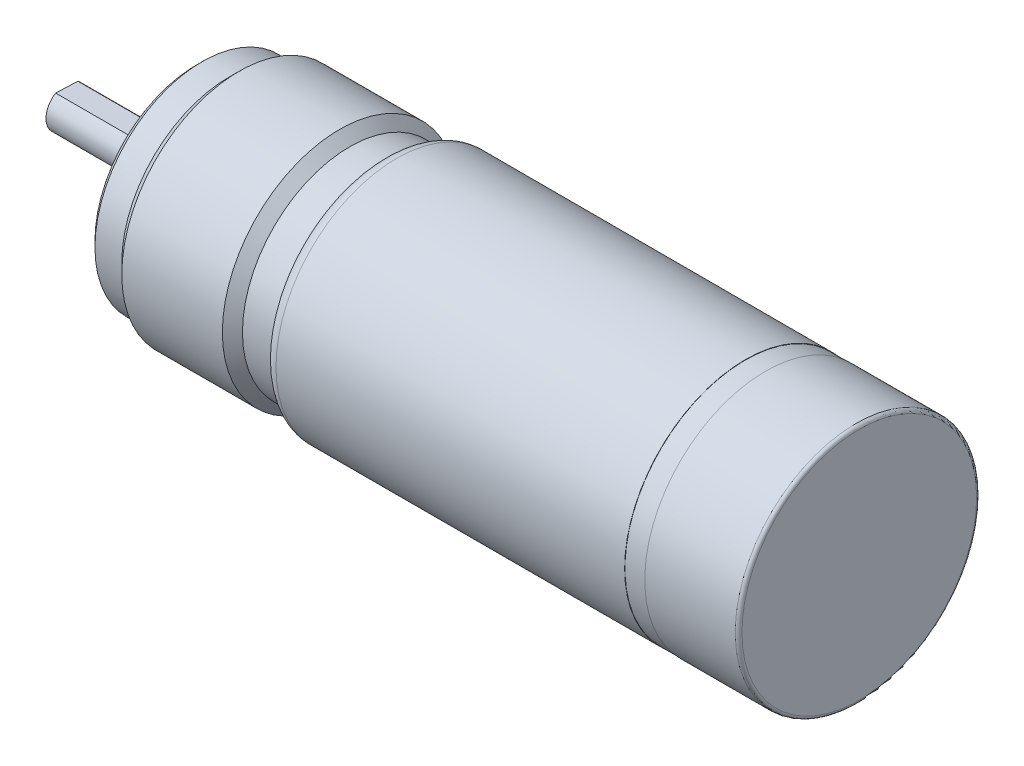
from build123d import *

# Parameters (mm, degrees)
SKETCH_1_W               = 16.3
SKETCH_1_H               = 3
SKETCH_1_W_2             = 5
SKETCH_1_H_2             = 16
SKETCH_19_W              = 3
SKETCH_19_H              = 0.05
EXTRUDE_START            = 14
SKETCH_20_R              = 18
EXTRUDE_2_DEPTH          = 14
CUT_EXTRUDE_6_DEPTH      = 3
CUT_EXTRUDE_4_DEPTH      = 12
SKETCH_13_R              = 1.5
CUT_EXTRUDE_8_DEPTH      = 7
PATTERN_CIRCULAR_2_COUNT = 4
FILLET_1_R               = 0.5


with BuildPart() as part:
    # Эскиз1 → Повернуть1 основной корпус (revolve)
    with BuildSketch(Plane(origin=(0, 0, 0), x_dir=(1, 0, 0), z_dir=(0, 1, 0)), mode=Mode.PRIVATE) as revolve_1_sk:
        with Locations((8.15, 1.5)):
            Rectangle(SKETCH_1_W, SKETCH_1_H)
        Polygon((16.3, 0), (19.3, 0), (19.3, 10), (16.3, 10), (16.3, 3), align=None)
        Polygon((24.3, 0), (24.3, 16), (20.3, 16), (19.3, 15), (19.3, 10), (19.3, 0), align=None)
        Polygon((40.8, 17.5), (42.3, 16), (42.3, 0), (24.3, 0), (24.3, 16), (25.8, 17.5), align=None)
        with Locations((44.8, 8)):
            Rectangle(SKETCH_1_W_2, SKETCH_1_H_2)
        with BuildLine():
            ThreePointArc((47.3, 16), (47.885786438, 17.414213562), (49.3, 18))
            Line((49.3, 18), (104.3, 18))
            Line((104.3, 18), (104.3, 0))
            Line((104.3, 0), (47.3, 0))
            Line((47.3, 0), (47.3, 16))
        make_face()
    revolve(revolve_1_sk.sketch.rotate(Axis((0, 0, 0), (1, 0, 0)), 180), axis=Axis((0, 0, 0), (1, 0, 0)))

    # Эскиз19 → Вырез-Повернуть2 пластиковая часть (revolve, cut)
    with BuildSketch(Plane(origin=(0, 0, 0), x_dir=(1, 0, 0), z_dir=(0, 1, 0)), mode=Mode.PRIVATE) as cut_revolve_2_sk:
        with Locations((102.8, 17.975)):
            Rectangle(SKETCH_19_W, SKETCH_19_H)
    revolve(cut_revolve_2_sk.sketch.rotate(Axis((103.004702911, 0, 0), (-1, 0, 0)), 180), axis=Axis((103.004702911, 0, 0), (-1, 0, 0)), mode=Mode.SUBTRACT)

    # Эскиз20 → Бобышка-Вытянуть2 пластиковая крышка контактов (add)
    with BuildSketch(Plane(origin=(104.3, 0, 0), x_dir=(0, 0, -1), z_dir=(1, 0, 0)).offset(EXTRUDE_START)):
        with Locations(Location((0, 0, 0), (0, 0, 180))):
            Circle(SKETCH_20_R)
    extrude(amount=-EXTRUDE_2_DEPTH)

    # Эскиз11 → Вырез-Вытянуть6 (cut)
    with BuildSketch(Plane.ZY.offset(-16.3)):
        with BuildLine():
            ThreePointArc((4.358898944, 9), (0, 10), (-4.358898944, 9))
            Line((-4.358898944, 9), (4.358898944, 9))
        make_face()
        with BuildLine():
            Line((4.358898944, -9), (-4.358898944, -9))
            ThreePointArc((-4.358898944, -9), (0, -10), (4.358898944, -9))
        make_face()
    extrude(amount=-CUT_EXTRUDE_6_DEPTH, mode=Mode.SUBTRACT)

    # Эскиз6 → Вырез-Вытянуть4 на оси (cut)
    with BuildSketch(Plane.ZY):
        with BuildLine():
            Line((-1.75306936, 2.434491286), (1.561110291, 2.561822527))
            ThreePointArc((1.561110291, 2.561822527), (-0.115175441, 2.997788288), (-1.75306936, 2.434491286))
        make_face()
    extrude(amount=-CUT_EXTRUDE_4_DEPTH, mode=Mode.SUBTRACT)

    # Эскиз13 → Вырез-Вытянуть8 для винтов (cut)
    with BuildSketch(Plane.ZY.offset(-19.3)):
        with Locations((-9.192388155, 9.192388155)):
            Circle(SKETCH_13_R)
    cut_extrude_8 = extrude(amount=-CUT_EXTRUDE_8_DEPTH, mode=Mode.SUBTRACT)

    # Круговой массив2 для винтов: Вырез-Вытянуть8 для винтов ×4 about axis
    pattern_circular_2_axis = Axis((0, 0, 0), (1, 0, 0))
    for i in range(1, PATTERN_CIRCULAR_2_COUNT):
        add(cut_extrude_8.rotate(pattern_circular_2_axis, i * 360 / PATTERN_CIRCULAR_2_COUNT), mode=Mode.SUBTRACT)

    # Скругление1
    # the kernel refuses this fillet: 0.5 mm, written as the material it takes off along each edge
    with BuildSketch(Plane(origin=(19.3, 0, 0), x_dir=(0, 0, 1), z_dir=(0, 1, 0))) as fillet_1_piece_1:
        with BuildLine():
            CenterArc((15 - FILLET_1_R * 0.414213562373, FILLET_1_R), FILLET_1_R, 270, 45)
            Line((15 - FILLET_1_R * 0.414213562373, 0), (15, 0))
            Line((15, 0), (15 + FILLET_1_R * 0.292893218813, FILLET_1_R * 0.292893218813))
        make_face()
    revolve(axis=Axis((19.3, 0, 0), (1, 0, 0)), mode=Mode.SUBTRACT)
    with BuildSketch(Plane(origin=(118.3, 0, 0), x_dir=(0, 0, 1), z_dir=(0, 1, 0))) as fillet_1_piece_2:
        with BuildLine():
            CenterArc((18 - FILLET_1_R, -FILLET_1_R), FILLET_1_R, 0, 90)
            Line((18 - FILLET_1_R, 0), (18, 0))
            Line((18, 0), (18, -FILLET_1_R))
        make_face()
    revolve(axis=Axis((118.3, 0, 0), (1, 0, 0)), mode=Mode.SUBTRACT)
    with BuildSketch(Plane(origin=(16.001803864, 9, -4.358898944), x_dir=(0, 0, 1), z_dir=(1, 0, 0))) as fillet_1_piece_3:
        with BuildLine():
            CenterArc((0.116258256, 0.5), FILLET_1_R, 243.474647983, 26.525352017)
            ThreePointArc((-0.107038622, 0.052631579), (-0.053597784, 0.026156196), (0, 0))
            Line((0, 0), (0.116258256, 0))
        make_face()
    extrude(amount=3.298196136, mode=Mode.SUBTRACT)
    with BuildSketch(Plane(origin=(16.001803864, 9, 4.358898944), x_dir=(0, -0.4412496727830022, 0.8973843804462464), z_dir=(1, 0, 0))) as fillet_1_piece_4:
        with BuildLine():
            CenterArc((0.116296493, 0.499991108), FILLET_1_R, 243.81635761, 26.525352017)
            Line((-0.104328343, 0.051298918), (0, 0))
            ThreePointArc((0, 0), (0.059639227, -0.000177843), (0.119278454, 0))
        make_face()
    extrude(amount=3.298196136, mode=Mode.SUBTRACT)
    with BuildSketch(Plane(origin=(16.3, 9, -5.608898944), x_dir=(1, 0, 0), z_dir=(0, 0, 1)), Plane(origin=(16.3, -9, 5.608898944), x_dir=(1, 0, 0), z_dir=(0, 0, -1))) as fillet_1_piece_5:
        with BuildLine():
            CenterArc((FILLET_1_R, -FILLET_1_R), FILLET_1_R, 90, 90)
            Line((0, -FILLET_1_R), (0, 0))
            Line((0, 0), (FILLET_1_R, 0))
        make_face()
    extrude(amount=11.217797887, mode=Mode.SUBTRACT)
    with BuildSketch(Plane(origin=(16.001803864, -9, 4.358898944), x_dir=(0, 0.4412496727830018, 0.8973843804462466), z_dir=(1, 0, 0))) as fillet_1_piece_6:
        with BuildLine():
            CenterArc((0.116296493, -0.499991108), FILLET_1_R, 89.658290373, 26.525352017)
            Line((-0.104328343, -0.051298918), (0, 0))
            ThreePointArc((0, 0), (0.059639227, 0.000177843), (0.119278454, 0))
        make_face()
    extrude(amount=3.298196136, mode=Mode.SUBTRACT)
    with BuildSketch(Plane(origin=(16.001803864, -9, -4.358898944), x_dir=(0, 0, 1), z_dir=(1, 0, 0))) as fillet_1_piece_7:
        with BuildLine():
            CenterArc((0.116258256, -0.5), FILLET_1_R, 90, 26.525352017)
            ThreePointArc((-0.107038622, -0.052631579), (-0.053597784, -0.026156196), (0, 0))
            Line((0, 0), (0.116258256, 0))
        make_face()
    extrude(amount=3.298196136, mode=Mode.SUBTRACT)
    with BuildSketch(Plane(origin=(19.3, 9.192388155, -9.192388155), x_dir=(0, 0, 1), z_dir=(0, -1, 0))) as fillet_1_piece_8:
        with BuildLine():
            CenterArc((1.5 + FILLET_1_R, -FILLET_1_R), FILLET_1_R, 90, 90)
            Line((1.5, -FILLET_1_R), (1.5, 0))
            Line((1.5, 0), (1.5 + FILLET_1_R, 0))
        make_face()
    revolve(axis=Axis((19.3, 9.192388155, -9.192388155), (-1, 0, 0)), mode=Mode.SUBTRACT)
    with BuildSketch(Plane(origin=(19.3, -9.192388155, -9.192388155), x_dir=(0, 1, 0), z_dir=(0, 0, 1))) as fillet_1_piece_9:
        with BuildLine():
            CenterArc((1.5 + FILLET_1_R, -FILLET_1_R), FILLET_1_R, 90, 90)
            Line((1.5, -FILLET_1_R), (1.5, 0))
            Line((1.5, 0), (1.5 + FILLET_1_R, 0))
        make_face()
    revolve(axis=Axis((19.3, -9.192388155, -9.192388155), (-1, 0, 0)), mode=Mode.SUBTRACT)
    with BuildSketch(Plane(origin=(19.3, -9.192388155, 9.192388155), x_dir=(0, 0, -1), z_dir=(0, 1, 0))) as fillet_1_piece_10:
        with BuildLine():
            CenterArc((1.5 + FILLET_1_R, -FILLET_1_R), FILLET_1_R, 90, 90)
            Line((1.5, -FILLET_1_R), (1.5, 0))
            Line((1.5, 0), (1.5 + FILLET_1_R, 0))
        make_face()
    revolve(axis=Axis((19.3, -9.192388155, 9.192388155), (-1, 0, 0)), mode=Mode.SUBTRACT)
    with BuildSketch(Plane(origin=(19.3, 9.192388155, 9.192388155), x_dir=(0, -1, 0), z_dir=(0, 0, -1))) as fillet_1_piece_11:
        with BuildLine():
            CenterArc((1.5 + FILLET_1_R, -FILLET_1_R), FILLET_1_R, 90, 90)
            Line((1.5, -FILLET_1_R), (1.5, 0))
            Line((1.5, 0), (1.5 + FILLET_1_R, 0))
        make_face()
    revolve(axis=Axis((19.3, 9.192388155, 9.192388155), (-1, 0, 0)), mode=Mode.SUBTRACT)
    # the kernel refuses this fillet: 0.5 mm, written as the material it adds along each edge
    with BuildSketch(Plane(origin=(19.3, 0, 0), x_dir=(0, -0.8947368421052432, -0.4465937565389121), z_dir=(0, -0.4465937565389121, 0.8947368421052432))) as fillet_1_2_piece_1:
        with BuildLine():
            CenterArc((10 + FILLET_1_R, -FILLET_1_R), FILLET_1_R, 90, 90)
            Line((10, -FILLET_1_R), (10, 0))
            Line((10, 0), (10 + FILLET_1_R, 0))
        make_face()
    revolve(axis=Axis((19.3, 0, 0), (1, 0, 0)), revolution_arc=126.949295967)
    with BuildSketch(Plane(origin=(19.3, 9, -4.242640687), x_dir=(0, 1, 0), z_dir=(0, 0, 1)), Plane(origin=(19.3, -9, 4.242640687), x_dir=(0, -1, 0), z_dir=(0, 0, -1))) as fillet_1_2_piece_2:
        with BuildLine():
            CenterArc((FILLET_1_R, FILLET_1_R), FILLET_1_R, 180, 90)
            Line((0, FILLET_1_R), (0, 0))
            Line((0, 0), (FILLET_1_R, 0))
        make_face()
    extrude(amount=8.485281374)
    with BuildSketch(Plane(origin=(19.3, 0, 0), x_dir=(0, 0.894736842105243, 0.44659375653891253), z_dir=(0, 0.44659375653891253, -0.894736842105243))) as fillet_1_2_piece_3:
        with BuildLine():
            CenterArc((10 + FILLET_1_R, -FILLET_1_R), FILLET_1_R, 90, 90)
            Line((10, -FILLET_1_R), (10, 0))
            Line((10, 0), (10 + FILLET_1_R, 0))
        make_face()
    revolve(axis=Axis((19.3, 0, 0), (1, 0, 0)), revolution_arc=126.949295967)
    with BuildSketch(Plane(origin=(19.3, -8.5, 4.242640687), x_dir=(0, -0.8947368421052433, 0.446593756538912), z_dir=(0, 0.446593756538912, 0.8947368421052433))) as fillet_1_2_piece_4:
        with BuildLine():
            CenterArc((0.5 + FILLET_1_R, -FILLET_1_R), FILLET_1_R, 90, 90)
            Line((0.5, -FILLET_1_R), (0.5, 0))
            Line((0.5, 0), (0.5 + FILLET_1_R, 0))
        make_face()
    revolve(axis=Axis((19.3, -8.5, 4.242640687), (1, 0, 0)), revolution_arc=26.525352017)
    with BuildSketch(Plane(origin=(19.3, -8.5, -4.242640687), x_dir=(0, -1, 0), z_dir=(0, 0, 1))) as fillet_1_2_piece_5:
        with BuildLine():
            CenterArc((0.5 + FILLET_1_R, -FILLET_1_R), FILLET_1_R, 90, 90)
            Line((0.5, -FILLET_1_R), (0.5, 0))
            Line((0.5, 0), (0.5 + FILLET_1_R, 0))
        make_face()
    revolve(axis=Axis((19.3, -8.5, -4.242640687), (1, 0, 0)), revolution_arc=26.525352017)
    with BuildSketch(Plane(origin=(19.3, 8.5, 4.242640687), x_dir=(0, 0.8947368421052433, 0.446593756538912), z_dir=(0, -0.446593756538912, 0.8947368421052433))) as fillet_1_2_piece_6:
        with BuildLine():
            CenterArc((0.5 + FILLET_1_R, FILLET_1_R), FILLET_1_R, 180, 90)
            Line((0.5, FILLET_1_R), (0.5, 0))
            Line((0.5, 0), (0.5 + FILLET_1_R, 0))
        make_face()
    revolve(axis=Axis((19.3, 8.5, 4.242640687), (-1, 0, 0)), revolution_arc=26.525352017)
    with BuildSketch(Plane(origin=(19.3, 8.5, -4.242640687), x_dir=(0, 1, 0), z_dir=(0, 0, 1))) as fillet_1_2_piece_7:
        with BuildLine():
            CenterArc((0.5 + FILLET_1_R, FILLET_1_R), FILLET_1_R, 180, 90)
            Line((0.5, FILLET_1_R), (0.5, 0))
            Line((0.5, 0), (0.5 + FILLET_1_R, 0))
        make_face()
    revolve(axis=Axis((19.3, 8.5, -4.242640687), (-1, 0, 0)), revolution_arc=26.525352017)


solid = part.part
